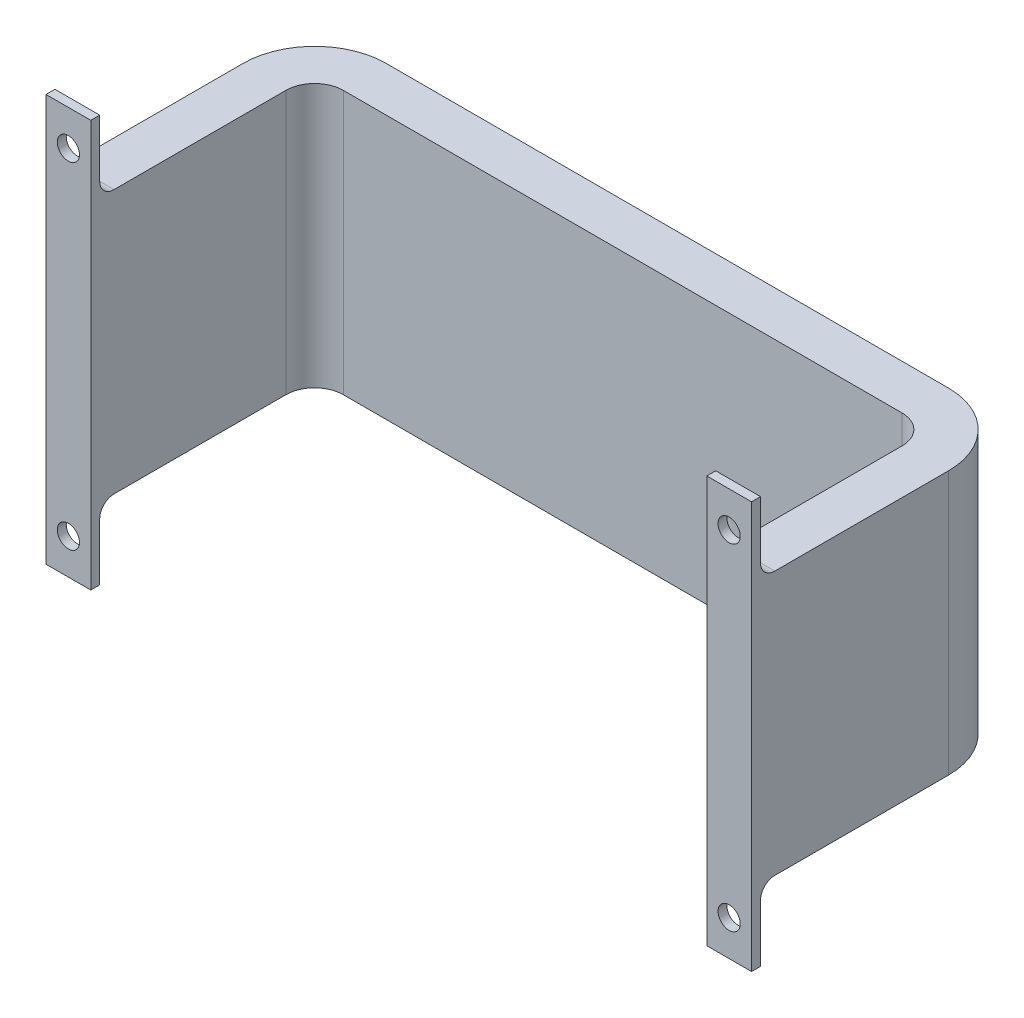
from build123d import *

# Parameters (mm, degrees)
SKETCH1_W           = 250.19
SKETCH1_H           = 93.472
BOSS_EXTRUDE1_DEPTH = 95.25
SKETCH5_W           = 218.44
SKETCH5_H           = 93.472
CUT_EXTRUDE1_DEPTH  = 79.375
SKETCH6_W           = 15.875
SKETCH6_H           = 25.4
BOSS_EXTRUDE2_DEPTH = 3.175
SKETCH7_R           = 3.937
CUT_EXTRUDE2_DEPTH  = 172.26052419
FILLET1_R           = 25.4
FILLET2_R           = 25.4
FILLET3_R           = 5.08
FILLET4_R           = 5.08
FILLET5_R           = 5.08
FILLET6_R           = 5.08
FILLET7_R           = 10.16
FILLET8_R           = 10.16


with BuildPart() as part:
    # Sketch1 → Boss-Extrude1 (new body)
    with BuildSketch(Plane.XY):
        Rectangle(SKETCH1_W, SKETCH1_H)
    extrude(amount=BOSS_EXTRUDE1_DEPTH)

    # Sketch5 → Cut-Extrude1 (cut)
    with BuildSketch(Plane.XY.offset(95.25)):
        Rectangle(SKETCH5_W, SKETCH5_H)
    extrude(amount=-CUT_EXTRUDE1_DEPTH, mode=Mode.SUBTRACT)

    # Sketch6 → Boss-Extrude2 (add)
    with BuildSketch(Plane.XY.offset(95.25)):
        with Locations((117.1575, 59.436)):
            Rectangle(SKETCH6_W, SKETCH6_H)
        with Locations((-117.1575, 59.436)):
            Rectangle(SKETCH6_W, SKETCH6_H)
        with Locations((117.1575, -59.436)):
            Rectangle(SKETCH6_W, SKETCH6_H)
        with Locations((-117.1575, -59.436)):
            Rectangle(SKETCH6_W, SKETCH6_H)
    extrude(amount=-BOSS_EXTRUDE2_DEPTH)

    # Sketch7 → Cut-Extrude2 (cut, through all)
    with BuildSketch(Plane(origin=(0, 0, 92.075), x_dir=(-1, 0, 0), z_dir=(0, 0, -1))):
        with Locations((117.1575, 59.5376)):
            Circle(SKETCH7_R)
        with Locations((-117.1575, 59.5376)):
            Circle(SKETCH7_R)
        with Locations((117.1575, -59.5376)):
            Circle(SKETCH7_R)
        with Locations((-117.1575, -59.5376)):
            Circle(SKETCH7_R)
    extrude(amount=-CUT_EXTRUDE2_DEPTH, mode=Mode.SUBTRACT)

    # Fillet1
    fillet1_edges = [part.edges().sort_by_distance(p)[0] for p in [
        (125.095, 0, 0),
    ]]
    fillet(fillet1_edges, radius=FILLET1_R)

    # Fillet2
    fillet2_edges = [part.edges().sort_by_distance(p)[0] for p in [
        (-125.095, 0, 0),
    ]]
    fillet(fillet2_edges, radius=FILLET2_R)

    # Fillet3
    fillet3_edges = [part.edges().sort_by_distance(p)[0] for p in [
        (117.1575, 46.736, 92.075),
    ]]
    fillet(fillet3_edges, radius=FILLET3_R)

    # Fillet4
    fillet4_edges = [part.edges().sort_by_distance(p)[0] for p in [
        (-117.1575, 46.736, 92.075),
    ]]
    fillet(fillet4_edges, radius=FILLET4_R)

    # Fillet5
    fillet5_edges = [part.edges().sort_by_distance(p)[0] for p in [
        (-117.1575, -46.736, 92.075),
    ]]
    fillet(fillet5_edges, radius=FILLET5_R)

    # Fillet6
    fillet6_edges = [part.edges().sort_by_distance(p)[0] for p in [
        (117.1575, -46.736, 92.075),
    ]]
    fillet(fillet6_edges, radius=FILLET6_R)

    # Fillet7
    fillet7_edges = [part.edges().sort_by_distance(p)[0] for p in [
        (-109.22, 0, 15.875),
    ]]
    fillet(fillet7_edges, radius=FILLET7_R)

    # Fillet8
    fillet8_edges = [part.edges().sort_by_distance(p)[0] for p in [
        (109.22, 0, 15.875),
    ]]
    fillet(fillet8_edges, radius=FILLET8_R)


solid = part.part
